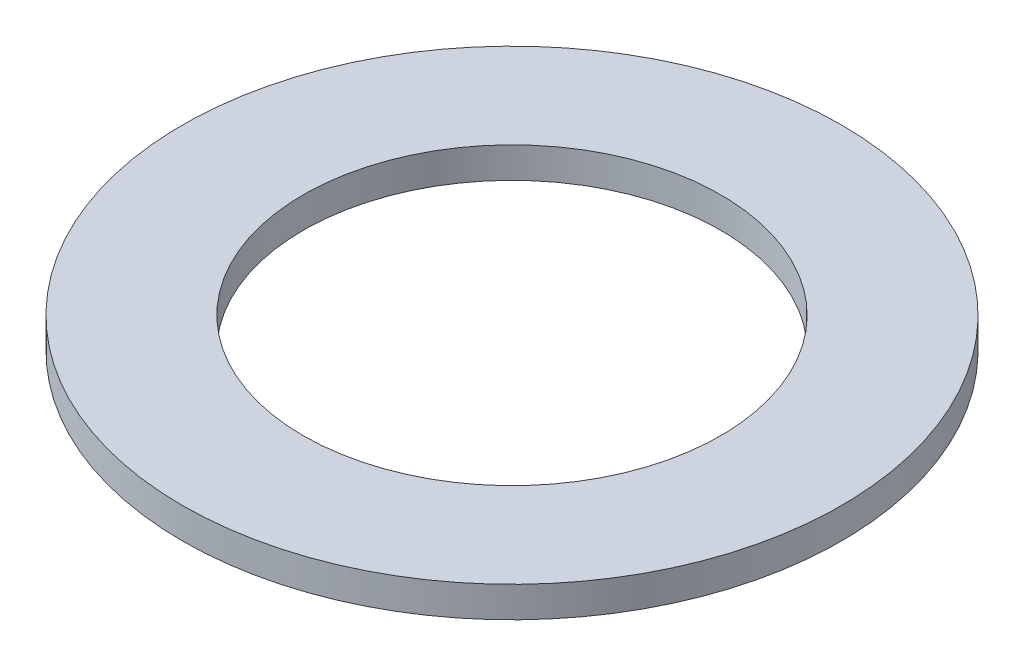
from build123d import *

# Parameters (mm, degrees)
SKETCH1_R           = 75
BOSS_EXTRUDE1_DEPTH = 7
SKETCH2_R           = 47.5
CUT_EXTRUDE1_DEPTH  = 107.296754419


with BuildPart() as part:
    # Sketch1 → Boss-Extrude1 (new body)
    with BuildSketch(Plane(origin=(0, 0, 0), x_dir=(1, 0, 0), z_dir=(0, 1, 0))):
        Circle(SKETCH1_R)
    extrude(amount=BOSS_EXTRUDE1_DEPTH)

    # Sketch2 → Cut-Extrude1 (cut, through all)
    with BuildSketch(Plane(origin=(0, 0, 0), x_dir=(1, 0, 0), z_dir=(0, 1, 0))):
        Circle(SKETCH2_R)
    extrude(amount=CUT_EXTRUDE1_DEPTH, mode=Mode.SUBTRACT)


solid = part.part
